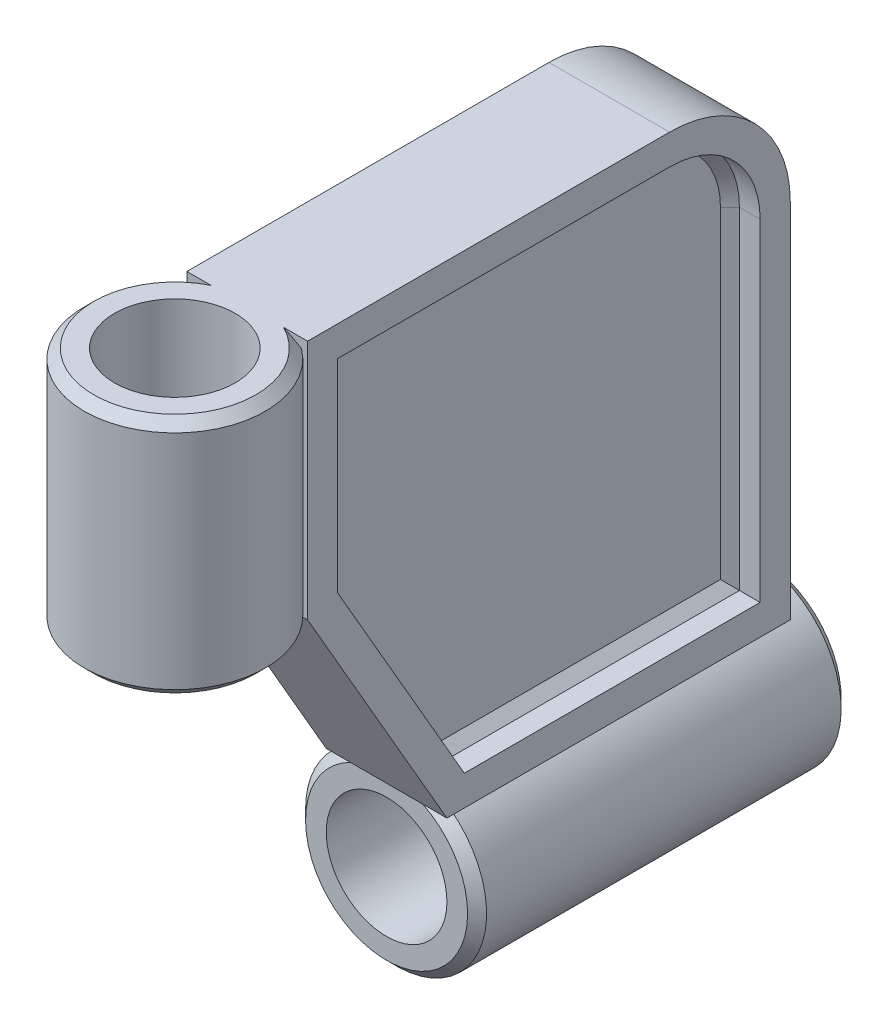
from build123d import *

# Parameters (mm, degrees)
BOSS_EXTRUDE1_DEPTH      = 6.35
FILLET1_R                = 12.7
CUT_EXTRUDE2_DEPTH       = 3.175
BOSS_EXTRUDE2_DEPTH      = 3.175
BOSS_EXTRUDE2_DEPTH_BACK = 36.135303
SKETCH4_R                = 9.525
SKETCH4_R_2              = 6.35
SKETCH5_R                = 9.525
SKETCH5_R_2              = 6.35
BOSS_EXTRUDE3_DEPTH      = 25.4
CHAMFER2_SIZE            = 1
CHAMFER4_SIZE            = 1


with BuildPart() as part:
    # Sketch1 → Boss-Extrude1 (new, symmetric)
    with BuildSketch(Plane.YZ):
        Polygon((-25.4, 10.735303163), (0, 25.4), (25.4, 25.4), (25.4, -25.4), (-25.4, -25.4), align=None)
    extrude(amount=BOSS_EXTRUDE1_DEPTH, both=True)

    # Fillet1
    fillet1_edges = [part.edges().sort_by_distance(p)[0] for p in [
        (0, 25.4, -25.4),
    ]]
    fillet(fillet1_edges, radius=FILLET1_R)

    # Sketch3 → Cut-Extrude2 (cut)
    with BuildSketch(Plane.YZ.offset(6.35)):
        with BuildLine():
            Line((-22.225, -22.225), (12.7, -22.225))
            ThreePointArc((12.7, -22.225), (19.435192091, -19.435192091), (22.225, -12.7))
            Line((22.225, -12.7), (22.225, 22.225))
            Line((22.225, 22.225), (0.850738686, 22.225))
            Line((0.850738686, 22.225), (-22.225, 8.902216058))
            Line((-22.225, 8.902216058), (-22.225, -22.225))
        make_face()
    cut_extrude2 = extrude(amount=-CUT_EXTRUDE2_DEPTH, mode=Mode.SUBTRACT)

    # Mirror1: Cut-Extrude2 across plane
    add(cut_extrude2.mirror(Plane(origin=(0, 0, 0), x_dir=(0, 0, 1), z_dir=(1, 0, 0))), mode=Mode.SUBTRACT)

    # Sketch4 → Boss-Extrude2 (add, two sides: drawn at the far end of the back side and taken through both)
    with BuildSketch(Plane(origin=(0, 0, -25.4), x_dir=(1, 0, 0), z_dir=(0, 0, -1)).offset(-BOSS_EXTRUDE2_DEPTH_BACK)):
        with Locations(Location((0, 33.02, 0), (0, 0, 233.130102354))):
            Circle(SKETCH4_R)
        with Locations(Location((0, 33.02, 0), (0, 0, 270))):
            Circle(SKETCH4_R_2, mode=Mode.SUBTRACT)
    extrude(amount=BOSS_EXTRUDE2_DEPTH + BOSS_EXTRUDE2_DEPTH_BACK)

    # Sketch5 → Boss-Extrude3 (add)
    with BuildSketch(Plane(origin=(0, 25.4, 0), x_dir=(-1, 0, 0), z_dir=(0, 1, 0))):
        with Locations((0, 33.02)):
            Circle(SKETCH5_R)
        with Locations(Location((0, 33.02, 0), (0, 0, 90))):
            Circle(SKETCH5_R_2, mode=Mode.SUBTRACT)
    extrude(amount=-BOSS_EXTRUDE3_DEPTH)

    # Chamfer2
    # the kernel refuses this chamfer: 1 mm, written as the material it takes off along each edge
    with BuildSketch(Plane(origin=(0, -33.02, 10.735303), x_dir=(0.3638595085405839, 0.931453841070294, 0), z_dir=(-0.931453841070294, 0.3638595085405839, 0))) as chamfer2_piece_1_section:
        Polygon((9.525, CHAMFER2_SIZE), (9.525 - CHAMFER2_SIZE, 0), (9.525, 0), align=None)
    chamfer2_piece_1 = revolve(axis=Axis((0, -33.02, 10.735303), (0, 0, -1)), revolution_arc=317.325176487, mode=Mode.PRIVATE)
    chamfer2_piece_1 = split(chamfer2_piece_1, bisect_by=Plane(origin=(5.777045626, -25.4, 10.24862198), z_dir=(0, -1, 0)), keep=Keep.TOP, mode=Mode.PRIVATE)
    add(chamfer2_piece_1, mode=Mode.SUBTRACT)
    with BuildSketch(Plane(origin=(0, -33.02, -28.575), x_dir=(-0.6000000000021781, 0.7999999999983665, 0), z_dir=(-0.7999999999983665, -0.6000000000021781, 0))) as chamfer2_piece_2:
        Polygon((9.525, -CHAMFER2_SIZE), (9.525 - CHAMFER2_SIZE, 0), (9.525, 0), align=None)
    revolve(axis=Axis((0, -33.02, -28.575), (0, 0, -1)), mode=Mode.SUBTRACT)
    with BuildSketch(Plane(origin=(0, 25.4, 33.02), x_dir=(-0.3638595085405501, 0, -0.9314538410703074), z_dir=(0.9314538410703074, 0, -0.3638595085405501))) as chamfer2_piece_3_section:
        Polygon((9.525, -CHAMFER2_SIZE), (9.525 - CHAMFER2_SIZE, 0), (9.525, 0), align=None)
    chamfer2_piece_3 = revolve(axis=Axis((0, 25.4, 33.02), (0, 1, 0)), revolution_arc=317.325176487, mode=Mode.PRIVATE)
    chamfer2_piece_3 = split(chamfer2_piece_3, bisect_by=Plane(origin=(0, 24.920234358, 25.4), z_dir=(0, 0, 1)), keep=Keep.TOP, mode=Mode.PRIVATE)
    add(chamfer2_piece_3, mode=Mode.SUBTRACT)
    with BuildSketch(Plane(origin=(0, 0, 33.02), x_dir=(-0.3638595085405531, 0, -0.9314538410703063), z_dir=(0.9314538410703063, 0, -0.3638595085405531))) as chamfer2_piece_4_section:
        Polygon((9.525, CHAMFER2_SIZE), (9.525 - CHAMFER2_SIZE, 0), (9.525, 0), align=None)
    chamfer2_piece_4 = revolve(axis=Axis((0, 0, 33.02), (0, 1, 0)), revolution_arc=317.325176487, mode=Mode.PRIVATE)
    chamfer2_piece_4 = split(chamfer2_piece_4, bisect_by=Plane(origin=(-5.452412952, 0.490850729, 25.4), z_dir=(0, 0, 1)), keep=Keep.TOP, mode=Mode.PRIVATE)
    add(chamfer2_piece_4, mode=Mode.SUBTRACT)

    # Chamfer4
    chamfer4_edges = [part.edges().sort_by_distance(p)[0] for p in [
        (3.175, -22.225, -6.661391971),
        (3.175, -10.687130657, 15.563608029),
        (3.175, 11.537869343, 22.225),
        (3.175, 22.225, 4.7625),
        (3.175, 19.435192091, -19.435192091),
        (3.175, -4.7625, -22.225),
        (-3.175, -22.225, -6.661391971),
        (-3.175, -4.7625, -22.225),
        (-3.175, 19.435192091, -19.435192091),
        (-3.175, 22.225, 4.7625),
        (-3.175, 11.537869343, 22.225),
        (-3.175, -10.687130657, 15.563608029),
    ]]
    chamfer(chamfer4_edges, length=CHAMFER4_SIZE)


solid = part.part
